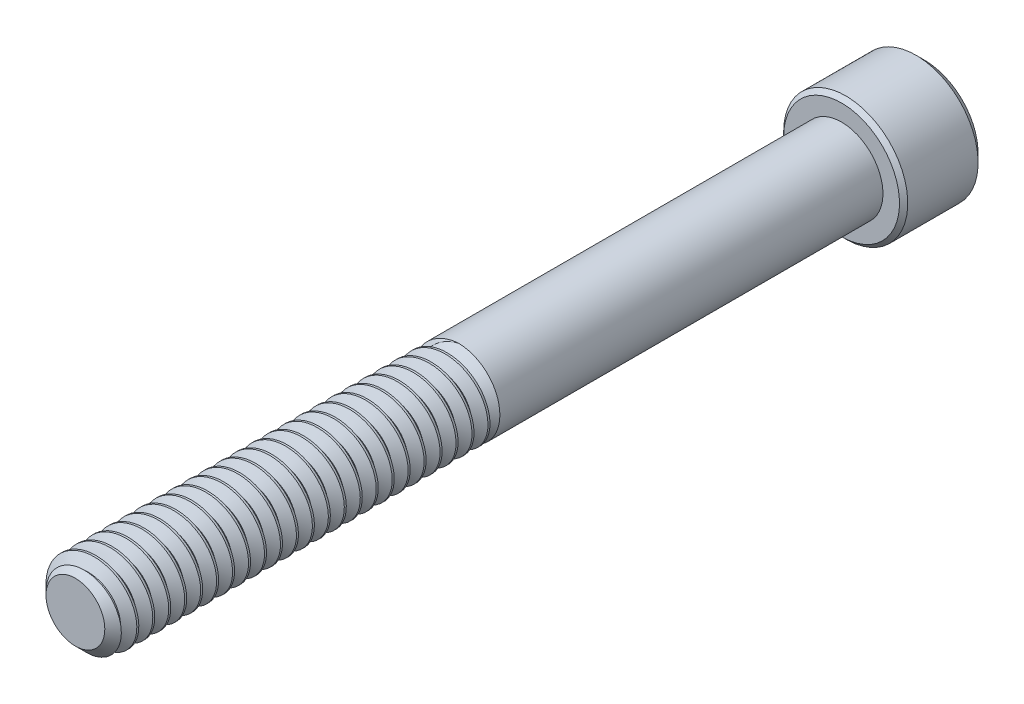
from build123d import *
from build123d.topology import SkipClean

# Parameters (mm, degrees)
SKETCH1_R          = 2.7432
EXTRUDE1_DEPTH     = 50.8
CHAMFER3_SIZE      = 0.79375
CUT_SWEEP1_PITCH   = 1.058333333
SKETCH6_R          = 4.1148
EXTRUDE2_DEPTH     = 5.4864
CUT_EXTRUDE1_DEPTH = 2.9765625
SKETCH8_R          = 2.291358881
CUT_EXTRUDE2_DEPTH = 0.54864
CUT_EXTRUDE2_DRAFT = -45
CHAMFER1_SIZE      = 0.54864
CHAMFER2_SIZE      = 0.27432


with BuildPart() as part:
    # Sketch1 → Extrude1 (new body)
    with BuildSketch(Plane.XY):
        Circle(SKETCH1_R)
    extrude(amount=-EXTRUDE1_DEPTH)

    # Chamfer3
    chamfer3_edges = [part.edges().sort_by_distance(p)[0] for p in [
        (-2.7432, 0, 0),
    ]]
    chamfer(chamfer3_edges, length=CHAMFER3_SIZE)

    # Cut-Sweep1: arcs per turn and ends read off the stored shape
    # Cut-Sweep1: the profile of Sketch3 profile screwed along a right-hand helix through 27 turns, 6 arcs to a turn; built about Z, then put on its axis
    cut_sweep1_z = Axis((0, 0, 0), (0, 0, 1))
    cut_sweep1_corners = [(2.7438, 0, -0.926388077), (2.055792336, 0, -0.529166667), (2.055792336, 0, -0.396875), (2.7438, 0, 0.00034641)]
    with BuildLine(mode=Mode.PRIVATE) as cut_sweep1_profile:
        Line(cut_sweep1_corners[0], cut_sweep1_corners[1])
        Line(cut_sweep1_corners[1], cut_sweep1_corners[2])
        Line(cut_sweep1_corners[2], cut_sweep1_corners[3])
        Line(cut_sweep1_corners[3], cut_sweep1_corners[0])
    cut_sweep1_cap = Face(cut_sweep1_profile.wire())
    cut_sweep1_turn_angles = [0, 30, 60, 90, 120, 150, 180, 210, 240, 270, 300, 330, 360]
    cut_sweep1_turn_weights = [1, 0.8660254037844387, 1, 0.8660254037844387, 1, 0.8660254037844387, 1, 0.8660254037844387, 1, 0.8660254037844387, 1, 0.8660254037844387, 1]
    cut_sweep1_turn_rails = [Edge.make_bspline([Vector(p[0], p[1], 0).rotate(cut_sweep1_z, cut_sweep1_turn_angles[k]) / cut_sweep1_turn_weights[k] + Vector(0, 0, p[2] + CUT_SWEEP1_PITCH * cut_sweep1_turn_angles[k] / 360) for k in range(13)], [0, 0, 0, 1, 1, 2, 2, 3, 3, 4, 4, 5, 5, 6, 6, 6], 2, cut_sweep1_turn_weights) for p in cut_sweep1_corners]
    cut_sweep1_turn_sides = [Face.make_surface_from_curves(cut_sweep1_turn_rails[p[0]], cut_sweep1_turn_rails[p[1]]) for p in [(0, 1), (1, 2), (2, 3), (3, 0)]]
    cut_sweep1 = Plane(origin=(0, 0, 0), x_dir=(0, 1, 0), z_dir=(0, 0, -1)) * Solid(Shell([*[p.moved(Location((0, 0, CUT_SWEEP1_PITCH * i))) for i in range(27) for p in cut_sweep1_turn_sides], cut_sweep1_cap, cut_sweep1_cap.rotate(cut_sweep1_z, 9720).moved(Location((0, 0, CUT_SWEEP1_PITCH * 9720 / 360)))]))
    add(cut_sweep1, mode=Mode.SUBTRACT)

    # Sketch5 → partially thread (revolve)
    with SkipClean():  # the faces are left unmerged after this step: merging them gives an invalid solid
        with BuildSketch(Plane(origin=(0, 0, 0), x_dir=(0, 0, -1), z_dir=(1, 0, 0)), mode=Mode.PRIVATE) as partially_thread_sk:
            Polygon((50.8, 2.7432), (25.4, 2.7432), (22.6568, 0), (25.4, 0), (50.8, 0), align=None)
        revolve(partially_thread_sk.sketch.rotate(Axis((0, 0, 0), (0, 0, -1)), 270), axis=Axis((0, 0, 0), (0, 0, -1)))

    # Sketch6 → Extrude2 (add)
    with BuildSketch(Plane(origin=(0, 0, -50.8), x_dir=(-1, 0, 0), z_dir=(0, 0, -1))):
        Circle(SKETCH6_R)
    extrude(amount=EXTRUDE2_DEPTH)

    # Sketch7 → Cut-Extrude1 (cut)
    with SkipClean():  # the faces are left unmerged after this step: merging them gives an invalid solid
        with BuildSketch(Plane(origin=(0, 0, -56.2864), x_dir=(-1, 0, 0), z_dir=(0, 0, -1))):
            Polygon((0, 2.291358881), (-1.984375, 1.14567944), (-1.984375, -1.14567944), (0, -2.291358881), (1.984375, -1.14567944), (1.984375, 1.14567944), align=None)
        extrude(amount=-CUT_EXTRUDE1_DEPTH, mode=Mode.SUBTRACT)
    add(part.part.scale(1), mode=Mode.REPLACE)  # the faces are merged on a copy


with BuildPart() as cut_extrude2_tool:
    # Sketch8 → Cut-Extrude2 (with draft: the straight prism first)
    with BuildSketch(Plane(origin=(0, 0, -56.2864), x_dir=(-1, 0, 0), z_dir=(0, 0, -1))):
        Circle(SKETCH8_R)
    extrude(amount=-CUT_EXTRUDE2_DEPTH)
    # Cut-Extrude2: the draft: its side faces are tilted about the plane it starts from
    cut_extrude2_sides = [cut_extrude2_tool.faces().sort_by_distance(p)[0] for p in [
        (2.291358881, 0, -56.01208),
    ]]
    draft(cut_extrude2_sides, Plane(origin=(0, 0, -56.2864), x_dir=(-1, 0, 0), z_dir=(0, 0, -1)), CUT_EXTRUDE2_DRAFT)


with BuildPart() as part_1:
    add(part.part)

    # Cut-Extrude2: cut by cut_extrude2_tool
    add(cut_extrude2_tool.part, mode=Mode.SUBTRACT)

    # Chamfer1
    chamfer1_edges = [part_1.edges().sort_by_distance(p)[0] for p in [
        (4.1148, 0, -56.2864),
    ]]
    chamfer(chamfer1_edges, length=CHAMFER1_SIZE)

    # Chamfer2
    chamfer2_edges = [part_1.edges().sort_by_distance(p)[0] for p in [
        (4.1148, 0, -50.8),
    ]]
    chamfer(chamfer2_edges, length=CHAMFER2_SIZE)


solid = part_1.part
